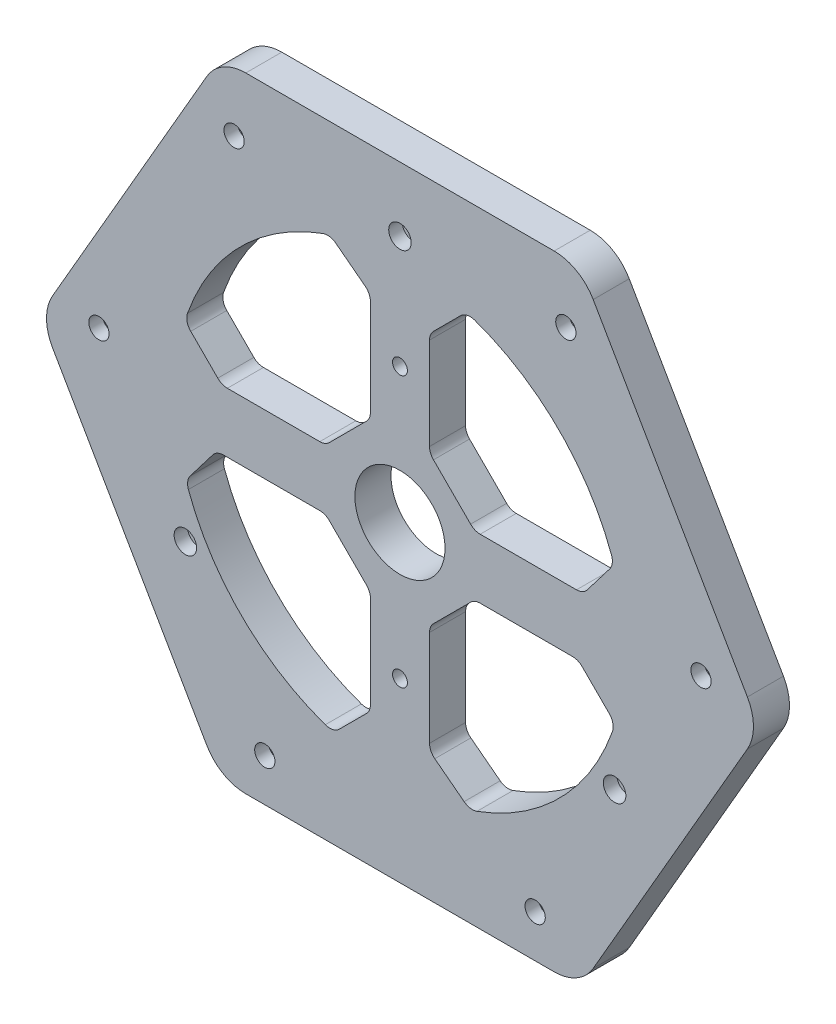
from build123d import *

# Parameters (mm, degrees)
BOSS_EXTRUDE1_DEPTH = 8
SKETCH2_R           = 2.25
CUT_EXTRUDE1_DEPTH  = 28
FILLET1_R           = 10
SKETCH5_R           = 1.65
CUT_EXTRUDE3_DEPTH  = 45
SKETCH10_R          = 4
CUT_EXTRUDE4_DEPTH  = 5
CUT_EXTRUDE5_DEPTH  = 10
CHAMFER1_SIZE       = 8.908764189
CHAMFER1_SIZE_2     = 10
CHAMFER1_SIZE_3     = 8.898783464
SKETCH12_R          = 10
CUT_EXTRUDE6_DEPTH  = 25.5
SKETCH13_R          = 1.65
CUT_EXTRUDE7_DEPTH  = 10
SKETCH14_R          = 2.55
CUT_EXTRUDE8_DEPTH  = 2.3
FILLET2_R           = 3
SKETCH15_R          = 2.5
CUT_EXTRUDE9_DEPTH  = 3


with BuildPart() as part:
    # Sketch1 → Boss-Extrude1 (new body)
    with BuildSketch(Plane.XY):
        Polygon((40, 69.282032303), (-40, 69.282032303), (-80, 0), (-40, -69.282032303), (40, -69.282032303), (80, 0), align=None)
    extrude(amount=BOSS_EXTRUDE1_DEPTH)

    # Sketch2 → Cut-Extrude1 (cut)
    with BuildSketch(Plane.XY.offset(8)):
        with Locations((-36.81613895, 55.896823885)):
            Circle(SKETCH2_R)
        with Locations((-66.81613895, 3.935299658)):
            Circle(SKETCH2_R)
        with Locations((36.81613895, 55.896823885)):
            Circle(SKETCH2_R)
        with Locations((66.81613895, 3.935299658)):
            Circle(SKETCH2_R)
        with Locations((30, -59.832123543)):
            Circle(SKETCH2_R)
        with Locations((-30, -59.832123543)):
            Circle(SKETCH2_R)
    extrude(amount=-CUT_EXTRUDE1_DEPTH, mode=Mode.SUBTRACT)

    # Fillet1
    fillet1_edges = [part.edges().sort_by_distance(p)[0] for p in [
        (80, 0, 4),
        (40, -69.282032303, 4),
        (-40, -69.282032303, 4),
        (-80, 0, 4),
        (-40, 69.282032303, 4),
        (40, 69.282032303, 4),
    ]]
    fillet(fillet1_edges, radius=FILLET1_R)

    # Sketch5 → Cut-Extrude3 (cut)
    with BuildSketch(Plane.XY.offset(8)):
        with Locations((0, 55)):
            Circle(SKETCH5_R)
        with Locations((47.631397208, -27.5)):
            Circle(SKETCH5_R)
        with Locations((-47.631397208, -27.5)):
            Circle(SKETCH5_R)
    extrude(amount=-CUT_EXTRUDE3_DEPTH, mode=Mode.SUBTRACT)

    # Sketch10 → Cut-Extrude4 (cut)
    with BuildSketch(Plane(origin=(0, 0, 0), x_dir=(-1, 0, 0), z_dir=(0, 0, -1))):
        with Locations((-30, -59.832123543)):
            Circle(SKETCH10_R)
        with Locations((-66.81613895, 3.935299658)):
            Circle(SKETCH10_R)
        with Locations((-36.81613895, 55.896823885)):
            Circle(SKETCH10_R)
        with Locations((36.81613895, 55.896823885)):
            Circle(SKETCH10_R)
        with Locations((66.81613895, 3.935299658)):
            Circle(SKETCH10_R)
        with Locations((30, -59.832123543)):
            Circle(SKETCH10_R)
    extrude(amount=-CUT_EXTRUDE4_DEPTH, mode=Mode.SUBTRACT)

    # Sketch11 → Cut-Extrude5 (cut)
    with BuildSketch(Plane(origin=(0, 0, 0), x_dir=(-1, 0, 0), z_dir=(0, 0, -1))):
        with BuildLine():
            Line((-6.556209751, -49.568297466), (-6.556209751, -6.628815438))
            Line((-6.556209751, -6.628815438), (-49.558640073, -6.628815438))
            ThreePointArc((-49.558640073, -6.628815438), (-35.329433507, -35.381225644), (-6.556209751, -49.568297466))
        make_face()
        with BuildLine():
            Line((6.556209751, -49.568297466), (6.556209751, -6.628815438))
            Line((6.556209751, -6.628815438), (49.558640073, -6.628815438))
            ThreePointArc((49.558640073, -6.628815438), (35.329433507, -35.381225644), (6.556209751, -49.568297466))
        make_face()
        with BuildLine():
            Line((-49.558640073, 6.628815438), (-6.556209751, 6.628815438))
            Line((-6.556209751, 6.628815438), (-6.556209751, 49.568297466))
            ThreePointArc((-6.556209751, 49.568297466), (-35.329433507, 35.381225644), (-49.558640073, 6.628815438))
        make_face()
        with BuildLine():
            Line((6.556209751, 6.628815438), (49.558640073, 6.628815438))
            ThreePointArc((49.558640073, 6.628815438), (35.329433507, 35.381225644), (6.556209751, 49.568297466))
            Line((6.556209751, 49.568297466), (6.556209751, 6.628815438))
        make_face()
    extrude(amount=-CUT_EXTRUDE5_DEPTH, mode=Mode.SUBTRACT)

    # Chamfer1
    # the kernel refuses this chamfer: 10, 8.908764189, 8.898783464 mm, written as the material it adds along each edge
    with BuildSketch(Plane(origin=(-6.556209751, 49.568297466, 0), x_dir=(-0.9751121847064436, -0.22171203674367113, 0), z_dir=(0, 0, 1)), Plane(origin=(6.556209751, -49.568297466, 0), x_dir=(0.9751121847064436, 0.22171203674367113, 0), z_dir=(0, 0, 1))) as chamfer1_piece_1:
        with BuildLine():
            Line((9.19369635, 0), (CHAMFER1_SIZE * 0.221712036732, CHAMFER1_SIZE * 0.975112184657))
            Line((CHAMFER1_SIZE * 0.221712036732, CHAMFER1_SIZE * 0.975112184657), (0, 0))
            ThreePointArc((0, 0), (4.724816594, -0.211594789), (9.19369635, 0))
        make_face()
    extrude(amount=8)
    with BuildSketch(Plane(origin=(-49.558640073, 6.628815438, 0), x_dir=(0.2152729733414999, 0.9765539139999951, 0), z_dir=(0, 0, 1)), Plane(origin=(49.558640073, -6.628815438, 0), x_dir=(-0.2152729733414999, -0.9765539139999951, 0), z_dir=(0, 0, 1))) as chamfer1_piece_2:
        with BuildLine():
            Line((8.390480284, 0), (CHAMFER1_SIZE_2 * 0.215272973341, -CHAMFER1_SIZE_2 * 0.976553914))
            Line((CHAMFER1_SIZE_2 * 0.215272973341, -CHAMFER1_SIZE_2 * 0.976553914), (0, 0))
            ThreePointArc((0, 0), (4.30291799, 0.17619531), (8.390480284, 0))
        make_face()
    extrude(amount=8)
    with BuildSketch(Plane(origin=(-6.556209751, 6.628815438, 0), x_dir=(-1, 0, 0), z_dir=(0, 0, 1)), Plane(origin=(-6.556209751, -6.628815438, 0), x_dir=(0, -1, 0), z_dir=(0, 0, 1)), Plane(origin=(6.556209751, -6.628815438, 0), x_dir=(1, 0, 0), z_dir=(0, 0, 1)), Plane(origin=(6.556209751, 6.628815438, 0), x_dir=(0, 1, 0), z_dir=(0, 0, 1))) as chamfer1_piece_3:
        Polygon((CHAMFER1_SIZE_2, 0), (0, -CHAMFER1_SIZE_2), (0, 0), align=None)
    extrude(amount=8)
    with BuildSketch(Plane(origin=(-49.558640073, -6.628815438, 0), x_dir=(0.22314024310111003, -0.9747863519298869, 0), z_dir=(0, 0, 1))) as chamfer1_piece_4:
        with BuildLine():
            Line((9.19369635, 0), (CHAMFER1_SIZE_3 * 0.223140243107, CHAMFER1_SIZE_3 * 0.974786351955))
            Line((CHAMFER1_SIZE_3 * 0.223140243107, CHAMFER1_SIZE_3 * 0.974786351955), (0, 0))
            ThreePointArc((0, 0), (4.724816594, -0.211594789), (9.19369635, 0))
        make_face()
    extrude(amount=8)
    with BuildSketch(Plane(origin=(-6.556209751, -49.568297466, 0), x_dir=(-0.9768521989550364, 0.21391536035710523, 0), z_dir=(0, 0, 1))) as chamfer1_piece_5:
        with BuildLine():
            Line((8.397944605, 0), (CHAMFER1_SIZE_2 * 0.213915360357, -CHAMFER1_SIZE_2 * 0.976852198955))
            Line((CHAMFER1_SIZE_2 * 0.213915360357, -CHAMFER1_SIZE_2 * 0.976852198955), (0, 0))
            ThreePointArc((0, 0), (4.306885367, 0.176509198), (8.397944605, 0))
        make_face()
    extrude(amount=8)
    with BuildSketch(Plane(origin=(6.556209751, 49.568297466, 0), x_dir=(0, -1, 0), z_dir=(0, 0, 1))) as chamfer1_piece_6:
        with BuildLine():
            Line((CHAMFER1_SIZE_2, 0), (1.796449346, 8.203550654))
            ThreePointArc((1.796449346, 8.203550654), (0.748885537, 4.24494847), (0, 0))
            Line((0, 0), (CHAMFER1_SIZE_2, 0))
        make_face()
    extrude(amount=8)
    with BuildSketch(Plane(origin=(49.558640073, 6.628815438, 0), x_dir=(-1, 0, 0), z_dir=(0, 0, 1))) as chamfer1_piece_7:
        with BuildLine():
            Line((CHAMFER1_SIZE_3, 0), (2.051483639, -8.961889726))
            ThreePointArc((2.051483639, -8.961889726), (0.848037011, -4.652902044), (0, 0))
            Line((0, 0), (CHAMFER1_SIZE_3, 0))
        make_face()
    extrude(amount=8)

    # Sketch12 → Cut-Extrude6 (cut)
    with BuildSketch(Plane(origin=(0, 0, 0), x_dir=(-1, 0, 0), z_dir=(0, 0, -1))):
        Circle(SKETCH12_R)
    extrude(amount=-CUT_EXTRUDE6_DEPTH, mode=Mode.SUBTRACT)

    # Sketch13 → Cut-Extrude7 (cut)
    with BuildSketch(Plane(origin=(0, 0, 0), x_dir=(-1, 0, 0), z_dir=(0, 0, -1))):
        with Locations((0, 30)):
            Circle(SKETCH13_R)
        with Locations(Location((0, -30, 0), (0, 0, 180))):
            Circle(SKETCH13_R)
    extrude(amount=-CUT_EXTRUDE7_DEPTH, mode=Mode.SUBTRACT)

    # Sketch14 → Cut-Extrude8 (cut)
    with BuildSketch(Plane(origin=(0, 0, 0), x_dir=(-1, 0, 0), z_dir=(0, 0, -1))):
        with Locations((0, -30)):
            Circle(SKETCH14_R)
        with Locations((0, 30)):
            Circle(SKETCH14_R)
    extrude(amount=-CUT_EXTRUDE8_DEPTH, mode=Mode.SUBTRACT)

    # Fillet2
    fillet2_edges = [part.edges().sort_by_distance(p)[0] for p in [
        (-6.556209751, -39.568297466, 4),
        (-6.556209751, -16.628815438, 4),
        (-40.659856609, -6.628815438, 4),
        (-16.556209751, -6.628815438, 4),
        (-14.759760405, -47.77184812, 4),
        (-47.507156434, -15.590705164, 4),
        (6.556209751, -16.628815438, 4),
        (6.556209751, -40.659533278, 4),
        (47.752396435, -14.8225718, 4),
        (15.521095085, -47.529944323, 4),
        (39.558640073, -6.628815438, 4),
        (16.556209751, -6.628815438, 4),
        (47.507156434, 15.590705164, 4),
        (14.759760405, 47.77184812, 4),
        (6.556209751, 16.628815438, 4),
        (6.556209751, 39.568297466, 4),
        (16.556209751, 6.628815438, 4),
        (40.659856609, 6.628815438, 4),
        (-15.521095085, 47.529944323, 4),
        (-47.752396435, 14.8225718, 4),
        (-16.556209751, 6.628815438, 4),
        (-39.558640073, 6.628815438, 4),
        (-6.556209751, 40.659533278, 4),
        (-6.556209751, 16.628815438, 4),
    ]]
    fillet(fillet2_edges, radius=FILLET2_R)

    # Sketch15 → Cut-Extrude9 (cut)
    with BuildSketch(Plane.XY.offset(8)):
        with Locations((-47.631397208, -27.5)):
            Circle(SKETCH15_R)
        with Locations((0, 55)):
            Circle(SKETCH15_R)
        with Locations((47.631397208, -27.5)):
            Circle(SKETCH15_R)
    extrude(amount=-CUT_EXTRUDE9_DEPTH, mode=Mode.SUBTRACT)


solid = part.part
